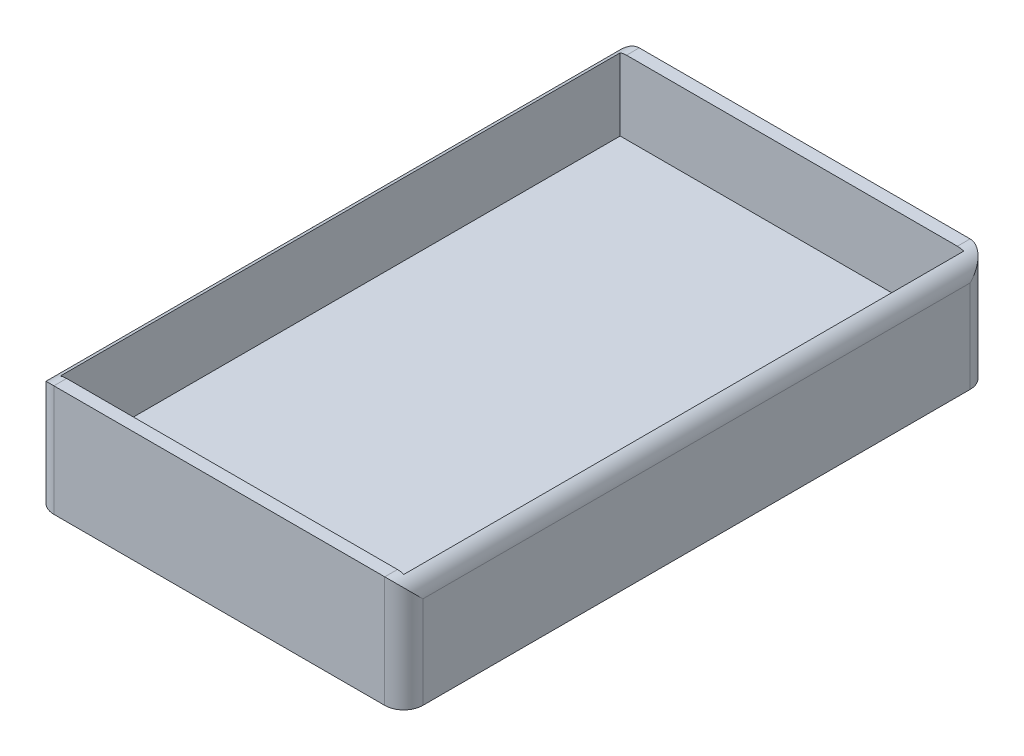
from build123d import *

# Parameters (mm, degrees)
SKETCH1_W           = 58
SKETCH1_H           = 92
BOSS_EXTRUDE1_DEPTH = 17.5
SKETCH2_W           = 54
SKETCH2_H           = 88
CUT_EXTRUDE1_DEPTH  = 11.5
FILLET3_R           = 3


with BuildPart() as part:
    # Sketch1 → Boss-Extrude1 (new body)
    with BuildSketch(Plane(origin=(0, 0, 0), x_dir=(1, 0, 0), z_dir=(0, 1, 0))):
        Rectangle(SKETCH1_W, SKETCH1_H)
    extrude(amount=BOSS_EXTRUDE1_DEPTH)

    # Sketch2 → Cut-Extrude1 (cut)
    with BuildSketch(Plane(origin=(0, 17.5, 0), x_dir=(1, 0, 0), z_dir=(0, 1, 0))):
        Rectangle(SKETCH2_W, SKETCH2_H)
    extrude(amount=-CUT_EXTRUDE1_DEPTH, mode=Mode.SUBTRACT)

    # Fillet3
    # the kernel refuses this fillet: 3 mm, written as the material it takes off along each edge
    with BuildSketch(Plane(origin=(29, -7.5, -46), x_dir=(0, 0, 1), z_dir=(0, 1, 0)), Plane(origin=(29, -7.5, 46), x_dir=(-1, 0, 0), z_dir=(0, 1, 0))) as fillet3_piece_1:
        with BuildLine():
            CenterArc((FILLET3_R, -FILLET3_R), FILLET3_R, 90, 90)
            Line((0, -FILLET3_R), (0, 0))
            Line((0, 0), (FILLET3_R, 0))
        make_face()
    extrude(amount=32.5, mode=Mode.SUBTRACT)
    with BuildSketch(Plane(origin=(29, 17.5, 53.5), x_dir=(0, -1, 0), z_dir=(0, 0, -1)), Plane(origin=(-29, 17.5, -53.5), x_dir=(0, -1, 0), z_dir=(0, 0, 1))) as fillet3_piece_2:
        with BuildLine():
            CenterArc((FILLET3_R, FILLET3_R), FILLET3_R, 180, 90)
            Line((0, FILLET3_R), (0, 0))
            Line((0, 0), (FILLET3_R, 0))
        make_face()
    extrude(amount=107, mode=Mode.SUBTRACT)
    with BuildSketch(Plane(origin=(-29, -7.5, -46), x_dir=(0, 0, 1), z_dir=(0, 1, 0)), Plane(origin=(-29, -7.5, 46), x_dir=(1, 0, 0), z_dir=(0, 1, 0))) as fillet3_piece_3:
        with BuildLine():
            CenterArc((FILLET3_R, FILLET3_R), FILLET3_R, 180, 90)
            Line((0, FILLET3_R), (0, 0))
            Line((0, 0), (FILLET3_R, 0))
        make_face()
    extrude(amount=32.5, mode=Mode.SUBTRACT)


solid = part.part
